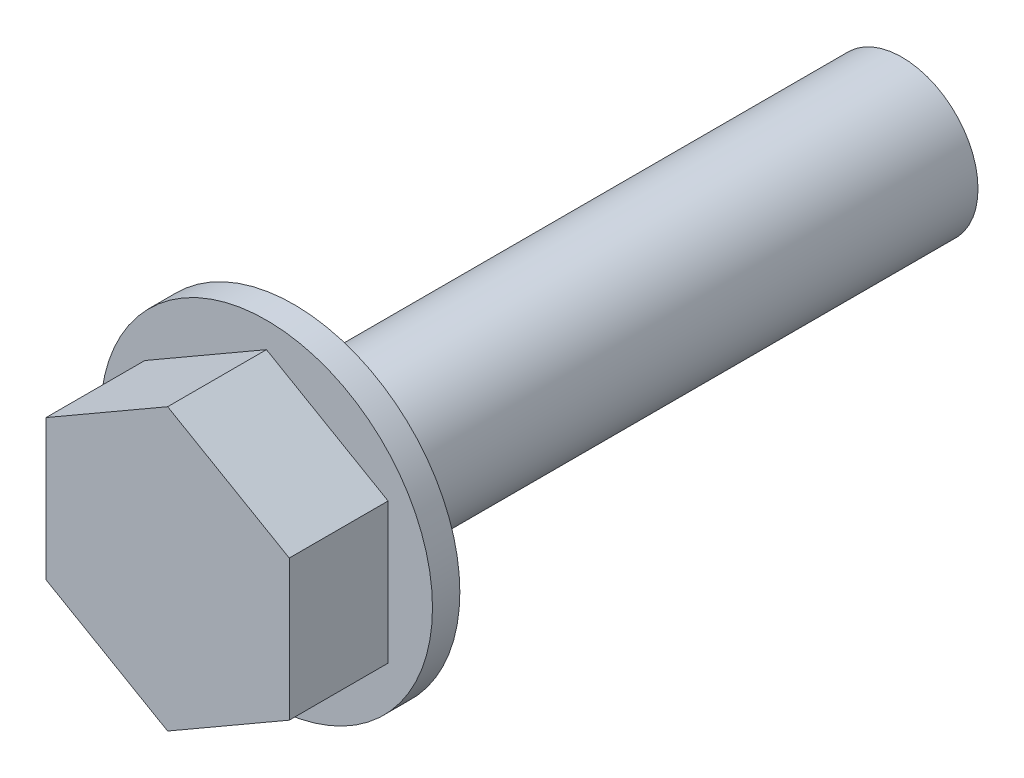
from build123d import *

# Parameters (mm, degrees)
EXTRUDE_SKETCH_1_R = 10.92
EXTRUDE_1_DEPTH    = 1.8
EXTRUDE_START      = 1.8
EXTRUDE_2_DEPTH    = 6.5
EXTRUDE_START_2    = -40
EXTRUDE_SKETCH_3_R = 5
EXTRUDE_3_DEPTH    = 40.01


with BuildPart() as part:
    # Extrude sketch 1 → Extrude 1 (new body)
    with BuildSketch(Plane.XY):
        Circle(EXTRUDE_SKETCH_1_R)
    extrude(amount=EXTRUDE_1_DEPTH)


with BuildPart() as body_2:
    # Extrude sketch 2 → Extrude 2 (new body)
    with BuildSketch(Plane.XY.offset(EXTRUDE_START)):
        Polygon((8, 4.618802154), (0, 9.237604307), (-8, 4.618802154), (-8, -4.618802154), (0, -9.237604307), (8, -4.618802154), align=None)
    extrude(amount=EXTRUDE_2_DEPTH)


with BuildPart() as body_3:
    # Extrude sketch 3 → Extrude 3 (new body)
    with BuildSketch(Plane.XY.offset(EXTRUDE_START_2)):
        Circle(EXTRUDE_SKETCH_3_R)
    extrude(amount=EXTRUDE_3_DEPTH)

    # Combine (weld / assembly of features): union body 2, part
    add(body_2.part)
    add(part.part)


solid = body_3.part
